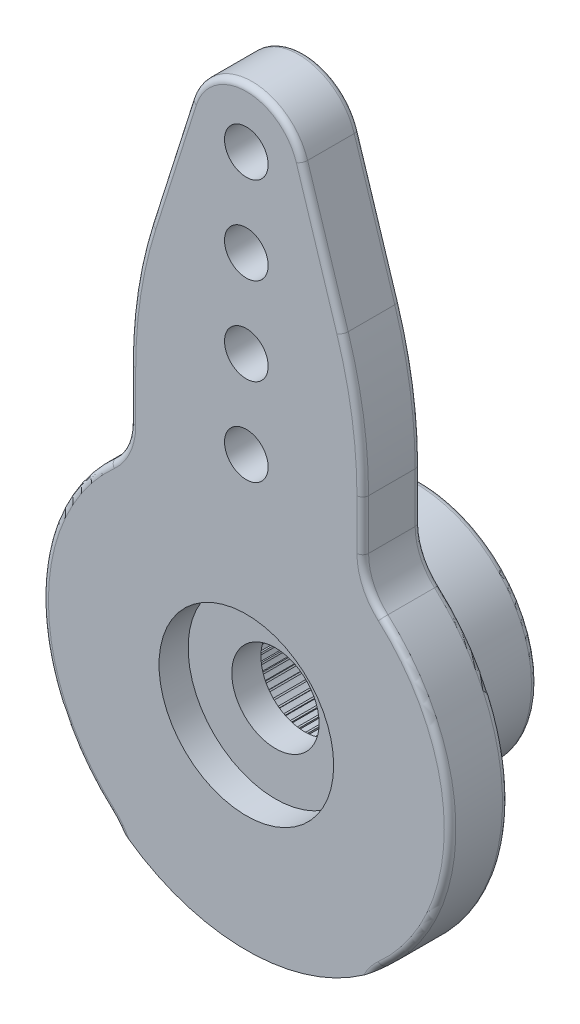
from build123d import *

# Parameters (mm, degrees)
SKETCH1_R                = 7
SKETCH1_R_2              = 1.5
SKETCH1_R_3              = 2
BOSS_EXTRUDE1_DEPTH      = 2
FILLET1_R                = 15
SKETCH2_R                = 0.75
CUT_EXTRUDE1_DEPTH       = 21.113739086
CIRPATTERN2_COUNT        = 2
FILLET1_OF_CIRPATTERN2_R = 15
FILLET2_R                = 2
SKETCH3_R                = 3
CUT_EXTRUDE2_DEPTH       = 1
SKETCH4_R                = 4
SKETCH4_R_2              = 3
BOSS_EXTRUDE2_DEPTH      = 4
SKETCH5_W                = 0.05
SKETCH5_H                = 0.5
BOSS_EXTRUDE3_DEPTH      = 4
CIRPATTERN3_COUNT        = 80
FILLET3_R                = 0.2
ENL_V_MAT_EXTRU_1_DEPTH  = 21.894078198


with BuildPart() as part:
    # Sketch1 → Boss-Extrude1 (new body)
    # profile 1 of 3: a face of its own
    with BuildSketch(Plane.XY):
        Circle(SKETCH1_R)
        Circle(SKETCH1_R_2, mode=Mode.SUBTRACT)
    # profile 2 of 3: a face of its own
    with BuildSketch(Plane.XY):
        with BuildLine():
            Line((-1.906651599, 17.353887141), (-4, 10.744562647))
            Line((-4, 10.744562647), (-4, 5.744562647))
            ThreePointArc((-4, 5.744562647), (0, 7), (4, 5.744562647))
            Line((4, 5.744562647), (4, 10.744562647))
            Line((4, 10.744562647), (1.906651599, 17.353887141))
            ThreePointArc((1.906651599, 17.353887141), (1.976525132, 17.055529705), (2, 16.75))
            ThreePointArc((2, 16.75), (-0.305529705, 14.773474868), (-1.906651599, 17.353887141))
        make_face()
    # profile 3 of 3: a face of its own
    with BuildSketch(Plane.XY):
        with Locations((0, 16.75)):
            Circle(SKETCH1_R_3)
    boss_extrude1 = extrude(amount=BOSS_EXTRUDE1_DEPTH)

    # Fillet1
    fillet1_edges = [part.edges().sort_by_distance(p)[0] for p in [
        (-4, 10.744562647, 1),
        (4, 10.744562647, 1),
    ]]
    fillet(fillet1_edges, radius=FILLET1_R)

    # Sketch2 → Cut-Extrude1 (cut, through all)
    with BuildSketch(Plane.XY.offset(2)):
        with Locations((0, 16.75)):
            Circle(SKETCH2_R)
        with Locations((0, 13.75)):
            Circle(SKETCH2_R)
        with Locations((0, 10.75)):
            Circle(SKETCH2_R)
        with Locations((0, 7.75)):
            Circle(SKETCH2_R)
    cut_extrude1 = extrude(amount=-CUT_EXTRUDE1_DEPTH, mode=Mode.SUBTRACT)

    # CirPattern2: Boss-Extrude1, Cut-Extrude1 ×2 about axis
    cirpattern2_axis = Axis((0, 0, 0), (0, 0, 1))
    add([boss_extrude1.rotate(cirpattern2_axis, i * 360 / CIRPATTERN2_COUNT) for i in range(1, CIRPATTERN2_COUNT)])
    add([cut_extrude1.rotate(cirpattern2_axis, i * 360 / CIRPATTERN2_COUNT) for i in range(1, CIRPATTERN2_COUNT)], mode=Mode.SUBTRACT)

    # Fillet1 of CirPattern2
    fillet1_of_cirpattern2_edges = [part.edges().sort_by_distance(p)[0] for p in [
        (4, -10.744562647, 1),
        (-4, -10.744562647, 1),
    ]]
    fillet(fillet1_of_cirpattern2_edges, radius=FILLET1_OF_CIRPATTERN2_R)

    # Fillet2
    fillet2_edges = [part.edges().sort_by_distance(p)[0] for p in [
        (-4, 5.744562647, 1),
        (4, 5.744562647, 1),
        (4, -5.744562647, 1),
        (-4, -5.744562647, 1),
    ]]
    fillet(fillet2_edges, radius=FILLET2_R)

    # Sketch3 → Cut-Extrude2 (cut)
    with BuildSketch(Plane.XY.offset(2)):
        Circle(SKETCH3_R)
    extrude(amount=-CUT_EXTRUDE2_DEPTH, mode=Mode.SUBTRACT)

    # Sketch4 → Boss-Extrude2 (add)
    with BuildSketch(Plane(origin=(0, 0, 0), x_dir=(-1, 0, 0), z_dir=(0, 0, -1))):
        with Locations(Location((0, 0, 0), (0, 0, 180))):
            Circle(SKETCH4_R)
        with Locations(Location((0, 0, 0), (0, 0, 180))):
            Circle(SKETCH4_R_2, mode=Mode.SUBTRACT)
    extrude(amount=BOSS_EXTRUDE2_DEPTH)

    # Sketch5 → Boss-Extrude3 (add)
    with BuildSketch(Plane(origin=(0, 0, -4), x_dir=(-1, 0, 0), z_dir=(0, 0, -1))):
        with Locations((0, -3.144105088)):
            Rectangle(SKETCH5_W, SKETCH5_H)
    boss_extrude3 = extrude(amount=-BOSS_EXTRUDE3_DEPTH)

    # CirPattern3: Boss-Extrude3 ×80 about axis
    cirpattern3_axis = Axis((0, 0, 0), (0, 0, 1))
    for i in range(1, CIRPATTERN3_COUNT):
        add(boss_extrude3.rotate(cirpattern3_axis, i * 360 / CIRPATTERN3_COUNT))

    # Fillet3
    fillet3_edges = [part.edges().sort_by_distance(p)[0] for p in [
        (-7, 0, 0),
        (-7, 0, 2),
        (7, 0, 0),
        (7, 0, 2),
        (-4.174258142, 5.891707352, 0),
        (-4.174258142, 5.891707352, 2),
        (-4.174258142, -5.891707352, 0),
        (-4.174258142, -5.891707352, 2),
        (4.174258142, -5.891707352, 0),
        (4.174258142, -5.891707352, 2),
        (4.174258142, 5.891707352, 0),
        (4.174258142, 5.891707352, 2),
        (-4, 0, 0),
        (2.603269296, 15.154457554, 2),
        (-4, 0, -4),
        (0, 18.75, 2),
        (-4, 7.567039169, 0),
        (-4, 7.567039169, 2),
        (-2.603269296, 15.154457554, 2),
        (4, 7.567039169, 0),
        (3.823938493, 10.717347197, 0),
        (-3.823938493, 10.717347197, 0),
        (4, 7.567039169, 2),
        (3.823938493, 10.717347197, 2),
        (-3.823938493, 10.717347197, 2),
        (0, -18.75, 2),
        (2.603269296, -15.154457554, 2),
        (-2.603269296, -15.154457554, 0),
        (-2.603269296, -15.154457554, 2),
        (0, -18.75, 0),
        (2.603269296, -15.154457554, 0),
        (4, -7.567039169, 0),
        (-2.603269296, 15.154457554, 0),
        (4, -7.567039169, 2),
        (-4, -7.567039169, 0),
        (-3.823938493, -10.717347197, 0),
        (3.823938493, -10.717347197, 0),
        (0, 18.75, 0),
        (-4, -7.567039169, 2),
        (-3.823938493, -10.717347197, 2),
        (3.823938493, -10.717347197, 2),
        (2.603269296, 15.154457554, 0),
    ]]
    fillet(fillet3_edges, radius=FILLET3_R)

    # Esquisse1 → Enlèv. mat.-Extru.1 (cut, through all)
    with BuildSketch(Plane.XY.offset(2)):
        with BuildLine():
            Line((-4.666666667, -5.217491947), (-3.925793651, -21.031651737))
            Line((-3.925793651, -21.031651737), (5.20113378, -20.604066943))
            Line((5.20113378, -20.604066943), (4.726698988, -5.163169248))
            ThreePointArc((4.726698988, -5.163169248), (0.040480969, -6.999882948), (-4.666666667, -5.217491947))
        make_face()
    extrude(amount=-ENL_V_MAT_EXTRU_1_DEPTH, mode=Mode.SUBTRACT)


solid = part.part
